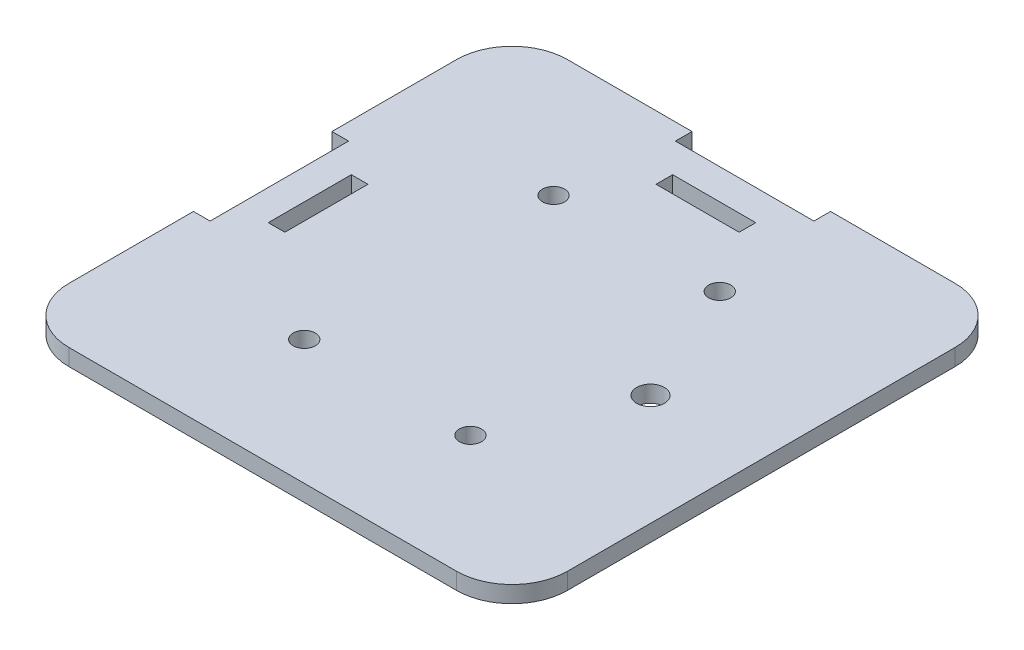
from build123d import *

# Parameters (mm, degrees)
BOSS_EXTRUDE1_DEPTH = 3
SKETCH2_R           = 2
CUT_EXTRUDE1_DEPTH  = 3
SKETCH3_W           = 15
SKETCH3_H           = 3
SKETCH3_W_2         = 3
SKETCH3_H_2         = 15
CUT_EXTRUDE2_DEPTH  = 10
SKETCH4_R           = 2.5
CUT_EXTRUDE3_DEPTH  = 14


with BuildPart() as part:
    # Sketch1 → Boss-Extrude1 (new body)
    with BuildSketch(Plane(origin=(0, 0, 0), x_dir=(1, 0, 0), z_dir=(0, 1, 0))):
        with BuildLine():
            Line((-35, -45), (35, -45))
            ThreePointArc((35, -45), (42.071067812, -42.071067812), (45, -35))
            Line((45, -35), (45, 35))
            ThreePointArc((45, 35), (42.071067812, 42.071067812), (35, 45))
            Line((35, 45), (12.5, 45))
            Line((12.5, 45), (12.5, 42))
            Line((12.5, 42), (-12.5, 42))
            Line((-12.5, 42), (-12.5, 45))
            Line((-12.5, 45), (-35, 45))
            ThreePointArc((-35, 45), (-42.071067812, 42.071067812), (-45, 35))
            Line((-45, 35), (-45, 12.5))
            Line((-45, 12.5), (-42, 12.5))
            Line((-42, 12.5), (-42, -12.5))
            Line((-42, -12.5), (-45, -12.5))
            Line((-45, -12.5), (-45, -35))
            ThreePointArc((-45, -35), (-42.071067812, -42.071067812), (-35, -45))
        make_face()
    extrude(amount=BOSS_EXTRUDE1_DEPTH)

    # Sketch2 → Cut-Extrude1 (cut)
    with BuildSketch(Plane(origin=(0, 3, 0), x_dir=(1, 0, 0), z_dir=(0, 1, 0))):
        with Locations((-15, 22.5)):
            Circle(SKETCH2_R)
        with Locations((15, 22.5)):
            Circle(SKETCH2_R)
        with Locations((15, -22.5)):
            Circle(SKETCH2_R)
        with Locations((-15, -22.5)):
            Circle(SKETCH2_R)
    extrude(amount=-CUT_EXTRUDE1_DEPTH, mode=Mode.SUBTRACT)

    # Sketch3 → Cut-Extrude2 (cut)
    with BuildSketch(Plane(origin=(0, 3, 0), x_dir=(1, 0, 0), z_dir=(0, 1, 0))):
        with Locations((0, 35)):
            Rectangle(SKETCH3_W, SKETCH3_H)
        with Locations((-35, 0)):
            Rectangle(SKETCH3_W_2, SKETCH3_H_2)
    extrude(amount=-CUT_EXTRUDE2_DEPTH, mode=Mode.SUBTRACT)

    # Sketch4 → Cut-Extrude3 (cut)
    with BuildSketch(Plane(origin=(0, 3, 0), x_dir=(1, 0, 0), z_dir=(0, 1, 0))):
        with Locations((25, 0)):
            Circle(SKETCH4_R)
    extrude(amount=-CUT_EXTRUDE3_DEPTH, mode=Mode.SUBTRACT)


solid = part.part
